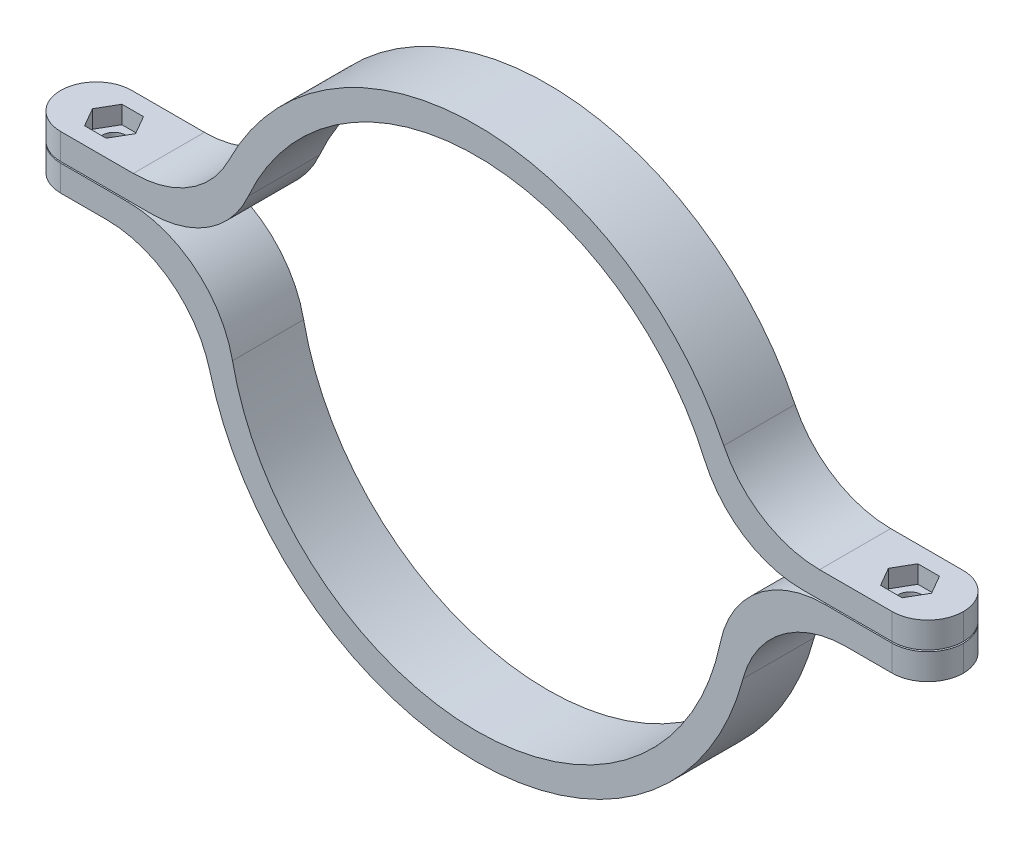
from build123d import *

# Parameters (mm, degrees)
SKETCH2_R               = 70
BOSS_EXTRUDE1_DEPTH     = 20
CUT_EXTRUDE1_DEPTH      = 267.030265755
CUT_EXTRUDE1_DEPTH_BACK = 267.030265755
SKETCH4_W               = 20
SKETCH4_H               = 0.4
FILLET1_R               = 30
FILLET2_R               = 30
FILLET3_R               = 10
FILLET4_R               = 10
CUT_EXTRUDE2_DEPTH      = 5
SKETCH6_R               = 3.25
CUT_EXTRUDE3_DEPTH      = 160.738733795


with BuildPart() as part:
    # Sketch2 → Boss-Extrude1 (new body)
    with BuildSketch(Plane.XY):
        with BuildLine():
            Line((-126.852130745, 2.5), (-77.459666924, 2.5))
            ThreePointArc((-77.459666924, 2.5), (0, -77.5), (77.459666924, 2.5))
            Line((77.459666924, 2.5), (126.852130745, 2.5))
            Line((126.852130745, 2.5), (126.852130745, 17.5))
            Line((126.852130745, 17.5), (75.498344353, 17.5))
            ThreePointArc((75.498344353, 17.5), (0, 77.5), (-75.498344353, 17.5))
            Line((-75.498344353, 17.5), (-126.852130745, 17.5))
            Line((-126.852130745, 17.5), (-126.852130745, 2.5))
        make_face()
        Circle(SKETCH2_R, mode=Mode.SUBTRACT)
    extrude(amount=-BOSS_EXTRUDE1_DEPTH)

    # Sketch4 → Cut-Extrude1 (cut, two sides: drawn at the far end of the back side and taken through both)
    with BuildSketch(Plane.ZY.offset(126.852130745).offset(-CUT_EXTRUDE1_DEPTH_BACK)):
        with Locations((-10, 10)):
            Rectangle(SKETCH4_W, SKETCH4_H)
    extrude(amount=CUT_EXTRUDE1_DEPTH + CUT_EXTRUDE1_DEPTH_BACK, mode=Mode.SUBTRACT)


with BuildPart() as cut_extrude1_piece_1:
    # of the separate pieces the step leaves, piece 1, a body of its own (cut_extrude1_pieces)
    add(part.part.solids().sort_by_distance((-126.852130745, 9.8, 0))[0])

    # Fillet2
    fillet2_edges = [cut_extrude1_piece_1.edges().sort_by_distance(p)[0] for p in [
        (77.459666924, 2.5, -10),
        (-77.459666924, 2.5, -10),
        (-69.310605249, 9.8, -10),
        (69.310605249, 9.8, -10),
    ]]
    fillet(fillet2_edges, radius=FILLET2_R)

    # Fillet4
    fillet4_edges = [cut_extrude1_piece_1.edges().sort_by_distance(p)[0] for p in [
        (126.852130745, 6.15, 0),
        (126.852130745, 6.15, -20),
        (-126.852130745, 6.15, 0),
        (-126.852130745, 6.15, -20),
    ]]
    fillet(fillet4_edges, radius=FILLET4_R - 0.0001)  # a hair under: the kernel refuses the full size


with BuildPart() as cut_extrude1_piece_2:
    # of the separate pieces the step leaves, piece 2, a body of its own (cut_extrude1_pieces)
    add(part.part.solids().sort_by_distance((-75.498344353, 17.5, 0))[0])

    # Fillet1
    fillet1_edges = [cut_extrude1_piece_2.edges().sort_by_distance(p)[0] for p in [
        (-75.498344353, 17.5, -10),
        (75.498344353, 17.5, -10),
        (69.252869977, 10.2, -10),
        (-69.252869977, 10.2, -10),
    ]]
    fillet(fillet1_edges, radius=FILLET1_R)

    # Fillet3
    fillet3_edges = [cut_extrude1_piece_2.edges().sort_by_distance(p)[0] for p in [
        (-126.852130745, 13.85, 0),
        (-126.852130745, 13.85, -20),
        (126.852130745, 13.85, 0),
        (126.852130745, 13.85, -20),
    ]]
    fillet(fillet3_edges, radius=FILLET3_R - 0.0001)  # a hair under: the kernel refuses the full size

    # Sketch5 → Cut-Extrude2 (cut)
    with BuildSketch(Plane(origin=(0, 17.5, 0), x_dir=(1, 0, 0), z_dir=(0, 1, 0))):
        Polygon((-117.914308268, 10.001916974), (-114.881559358, 15.250958224), (-108.819381835, 15.249041251), (-105.789953221, 9.998083026), (-108.822702131, 4.749041776), (-114.884879654, 4.750958749), align=None)
        Polygon((114.881559358, 15.250958224), (108.819381835, 15.249041251), (105.789953221, 9.998083026), (108.822702131, 4.749041776), (114.884879654, 4.750958749), (117.914308268, 10.001916974), align=None)
    extrude(amount=-CUT_EXTRUDE2_DEPTH, mode=Mode.SUBTRACT)


with BuildPart() as cut_extrude3_tool:
    # Sketch6 → Cut-Extrude3 (new, through all)
    with BuildSketch(Plane(origin=(0, 17.5, 0), x_dir=(1, 0, 0), z_dir=(0, 1, 0))):
        with Locations(Location((-111.852130745, 10, 0), (0, 0, 270))):
            Circle(SKETCH6_R)
        with Locations(Location((111.852130745, 10, 0), (0, 0, 270))):
            Circle(SKETCH6_R)
    extrude(amount=-CUT_EXTRUDE3_DEPTH)


with BuildPart() as cut_extrude1_piece_1_1:
    add(cut_extrude1_piece_1.part)

    # Cut-Extrude3: cut by cut_extrude3_tool
    add(cut_extrude3_tool.part, mode=Mode.SUBTRACT)


with BuildPart() as cut_extrude1_piece_2_1:
    add(cut_extrude1_piece_2.part)

    # Cut-Extrude3: cut by cut_extrude3_tool
    add(cut_extrude3_tool.part, mode=Mode.SUBTRACT)


solid = Compound([cut_extrude1_piece_1_1.part, cut_extrude1_piece_2_1.part])
